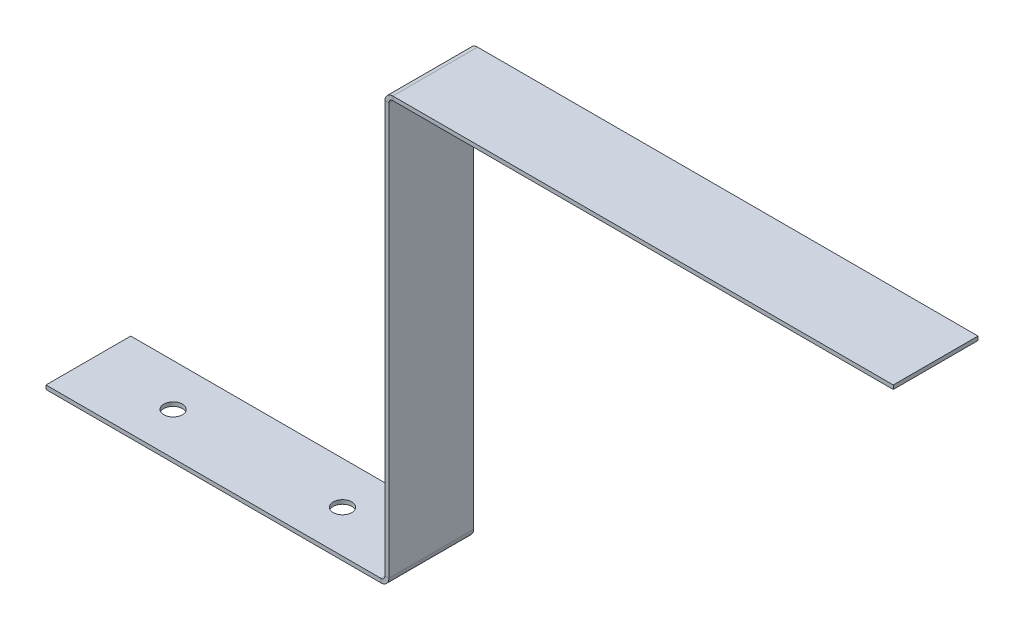
from build123d import *

# Parameters (mm, degrees)
BASE_FLANGE1_DEPTH = 15
SKETCH6_R          = 1.64265796
CUT_EXTRUDE1_DEPTH = 0.7


# Sheet-metal steps are written as plain solids
with BuildPart() as part:
    # Sketch1 → Base-Flange1 (new body)
    with BuildSketch(Plane.XY):
        with BuildLine():
            Line((0, 0), (59.3, 0))
            ThreePointArc((59.3, 0), (59.794974747, 0.205025253), (60, 0.7))
            Line((60, 0.7), (60, 73.6))
            ThreePointArc((60, 73.6), (60.410050506, 74.589949494), (61.4, 75))
            Line((61.4, 75), (150, 75))
            Line((150, 75), (150, 74.3))
            Line((150, 74.3), (61.4, 74.3))
            ThreePointArc((61.4, 74.3), (60.905025253, 74.094974747), (60.7, 73.6))
            Line((60.7, 73.6), (60.7, 0.7))
            ThreePointArc((60.7, 0.7), (60.289949494, -0.289949494), (59.3, -0.7))
            Line((59.3, -0.7), (0, -0.7))
            Line((0, -0.7), (0, 0))
        make_face()
    extrude(amount=BASE_FLANGE1_DEPTH)

    # Sketch6 → Cut-Extrude1 (cut)
    with BuildSketch(Plane(origin=(0, 0, 0), x_dir=(1, 0, 0), z_dir=(0, 1, 0))):
        with Locations(Location((15, -7.5, 0), (0, 0, 270))):
            Circle(SKETCH6_R)
        with Locations(Location((45, -7.5, 0), (0, 0, 270))):
            Circle(SKETCH6_R)
    extrude(amount=-CUT_EXTRUDE1_DEPTH, mode=Mode.SUBTRACT)


solid = part.part
